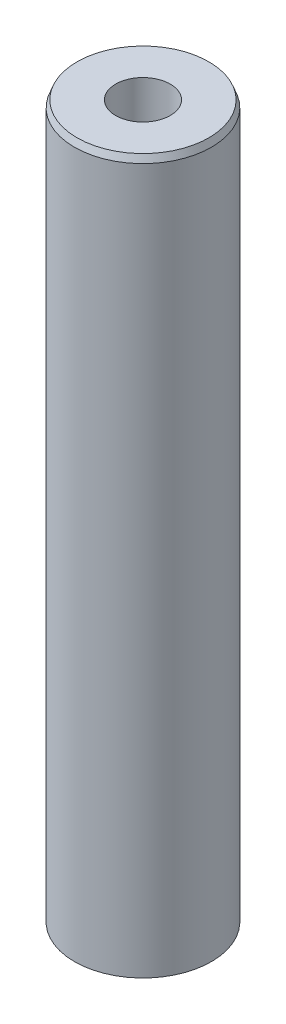
from build123d import *
from OCP.BRepFilletAPI import BRepFilletAPI_MakeChamfer

# Parameters (mm, degrees)
SKETCH1_R           = 57.5
BOSS_EXTRUDE1_DEPTH = 600
SKETCH2_R           = 22.908233339
CUT_EXTRUDE1_DEPTH  = 606.485342515
CHAMFER1_SIZE       = 5.753773427
CHAMFER1_SIZE2      = 2.189275754


with BuildPart() as part:
    # Sketch1 → Boss-Extrude1 (new body)
    with BuildSketch(Plane(origin=(0, 0, 0), x_dir=(1, 0, 0), z_dir=(0, 1, 0))):
        Circle(SKETCH1_R)
    extrude(amount=BOSS_EXTRUDE1_DEPTH)

    # Sketch2 → Cut-Extrude1 (cut, through all)
    with BuildSketch(Plane(origin=(0, 0, 0), x_dir=(1, 0, 0), z_dir=(0, 1, 0))):
        Circle(SKETCH2_R)
    extrude(amount=CUT_EXTRUDE1_DEPTH, mode=Mode.SUBTRACT)

    # Chamfer1: one chamfer whose edges measure the first distance from different faces: ONE call of the kernel's chamfer builder (chamfer() names one face for all edges)
    chamfer1_edges_1 = [part.edges().sort_by_distance(p)[0] for p in [
        (-57.5, 600, 0),
    ]]
    chamfer1_side_1 = [part.faces().sort_by_distance(p)[0] for p in [
        (-57.5, 300, 0),
    ]]
    chamfer1_edges_2 = [part.edges().sort_by_distance(p)[0] for p in [
        (-57.5, 0, 0),
    ]]
    chamfer1_side_2 = [part.faces().sort_by_distance(p)[0] for p in [
        (-55.873654403, 0, 0),
    ]]
    chamfer1 = BRepFilletAPI_MakeChamfer(part.part.solid().wrapped)
    for e in chamfer1_edges_1:
        chamfer1.Add(CHAMFER1_SIZE, CHAMFER1_SIZE2, e.wrapped, chamfer1_side_1[0].wrapped)  # the first distance lies on this face
    for e in chamfer1_edges_2:
        chamfer1.Add(CHAMFER1_SIZE, CHAMFER1_SIZE2, e.wrapped, chamfer1_side_2[0].wrapped)  # the first distance lies on this face
    add(Compound.cast(chamfer1.Shape()), mode=Mode.REPLACE)


solid = part.part
